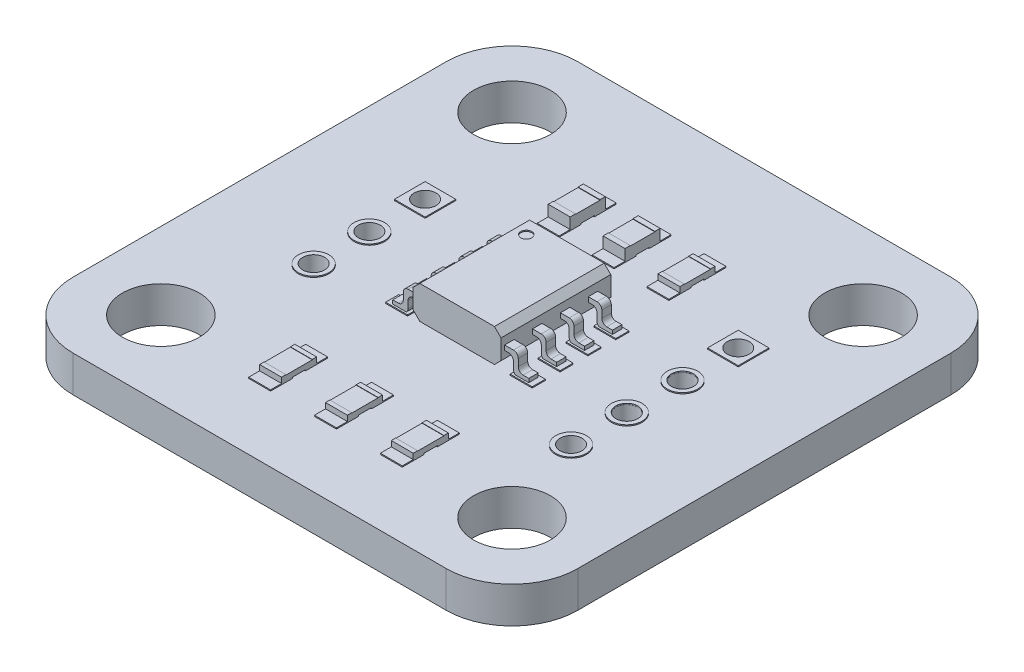
from build123d import *
from build123d.topology import SkipClean

# Parameters (mm, degrees)
SKETCH1_R              = 1.75
SKETCH1_R_2            = 0.5
BOSS_EXTRUDE1_DEPTH    = 1.65
SKETCH3_R              = 0.7
SKETCH3_R_2            = 0.5
SKETCH3_R_3            = 0.503152614
SKETCH3_W              = 1.4
SKETCH3_H              = 1.4
BOSS_EXTRUDE2_DEPTH    = 0.05
BOSS_EXTRUDE4_DEPTH    = 5
BOSS_EXTRUDE6_DEPTH    = 0.43
FILLET1_R              = 0.22
LPATTERN3_COUNT        = 3
LPATTERN3_PITCH        = 1.27
FILLET1_OF_LPATTERN3_R = 0.22
LPATTERN4_COUNT        = 2
LPATTERN4_PITCH        = 1.27
FILLET1_OF_LPATTERN4_R = 0.22
MIRROR2_START          = -1.905
MIRROR2_DEPTH          = 0.43
MIRROR2_START_2        = -0.635
MIRROR2_2_DEPTH        = 0.43
MIRROR2_START_3        = 0.635
MIRROR2_3_DEPTH        = 0.43
MIRROR2_START_4        = 1.905
MIRROR2_4_DEPTH        = 0.43
BOSS_EXTRUDE7_START    = 0.05
SKETCH8_R              = 0.7
SKETCH8_R_2            = 0.5
SKETCH8_W              = 1.4
SKETCH8_H              = 1.4
BOSS_EXTRUDE7_DEPTH    = 0.05
SKETCH9_R              = 0.25
CUT_EXTRUDE1_DEPTH     = 0.05
SKETCH10_W             = 1
SKETCH10_H             = 0.6
BOSS_EXTRUDE8_DEPTH    = 0.05
SKETCH12_W             = 1
SKETCH12_H             = 1
BOSS_EXTRUDE9_DEPTH    = 0.05
SKETCH15_W             = 1
SKETCH15_H             = 1.6
BOSS_EXTRUDE11_DEPTH   = 0.25
SKETCH16_W             = 1
SKETCH16_H             = 1.2
CUT_EXTRUDE4_DEPTH     = 0.015
SKETCH17_W             = 1
SKETCH17_H             = 1.6
BOSS_EXTRUDE12_DEPTH   = 0.5
SKETCH18_W             = 1
SKETCH18_H             = 1.12020849
CUT_EXTRUDE5_DEPTH     = 0.02


# Read off the part's stored shape, not the designer's step: Mirror2
with BuildPart() as part:
    # Sketch1 → Boss-Extrude1 (new body)
    with BuildSketch(Plane(origin=(0, 0, 0), x_dir=(1, 0, 0), z_dir=(0, 1, 0))):
        with BuildLine():
            Line((-8.5, 11.5), (8.5, 11.5))
            ThreePointArc((8.5, 11.5), (10.621320344, 10.621320344), (11.5, 8.5))
            Line((11.5, 8.5), (11.5, -8.5))
            ThreePointArc((11.5, -8.5), (10.621320344, -10.621320344), (8.5, -11.5))
            Line((8.5, -11.5), (-8.5, -11.5))
            ThreePointArc((-8.5, -11.5), (-10.621320344, -10.621320344), (-11.5, -8.5))
            Line((-11.5, -8.5), (-11.5, 8.5))
            ThreePointArc((-11.5, 8.5), (-10.621320344, 10.621320344), (-8.5, 11.5))
        make_face()
        with Locations(Location((-8, 8, 0), (0, 0, 270))):
            Circle(SKETCH1_R, mode=Mode.SUBTRACT)
        with Locations(Location((8, 8, 0), (0, 0, 270))):
            Circle(SKETCH1_R, mode=Mode.SUBTRACT)
        with Locations(Location((8, -8, 0), (0, 0, 270))):
            Circle(SKETCH1_R, mode=Mode.SUBTRACT)
        with Locations(Location((-8, -8, 0), (0, 0, 270))):
            Circle(SKETCH1_R, mode=Mode.SUBTRACT)
        with Locations(Location((-6.5, 0, 0), (0, 0, 270))):
            Circle(SKETCH1_R_2, mode=Mode.SUBTRACT)
        with Locations(Location((-6.5, 2.54, 0), (0, 0, 270))):
            Circle(SKETCH1_R_2, mode=Mode.SUBTRACT)
        with Locations(Location((-6.5, -2.54, 0), (0, 0, 270))):
            Circle(SKETCH1_R_2, mode=Mode.SUBTRACT)
        with Locations(Location((6.5, 3.81, 0), (0, 0, 270))):
            Circle(SKETCH1_R_2, mode=Mode.SUBTRACT)
        with Locations(Location((6.5, 1.27, 0), (0, 0, 270))):
            Circle(SKETCH1_R_2, mode=Mode.SUBTRACT)
        with Locations(Location((6.5, -1.27, 0), (0, 0, 270))):
            Circle(SKETCH1_R_2, mode=Mode.SUBTRACT)
        with Locations(Location((6.5, -3.81, 0), (0, 0, 270))):
            Circle(SKETCH1_R_2, mode=Mode.SUBTRACT)
    extrude(amount=BOSS_EXTRUDE1_DEPTH)

    # Sketch3 → Boss-Extrude2 (add)
    # profile 1 of 7: a face of its own
    with BuildSketch(Plane(origin=(0, 1.65, 0), x_dir=(1, 0, 0), z_dir=(0, 1, 0))):
        with Locations(Location((-6.5, 0, 0), (0, 0, 90))):
            Circle(SKETCH3_R)
        with Locations(Location((-6.5, 0, 0), (0, 0, 270))):
            Circle(SKETCH3_R_2, mode=Mode.SUBTRACT)
    # profile 2 of 7: a face of its own
    with BuildSketch(Plane(origin=(0, 1.65, 0), x_dir=(1, 0, 0), z_dir=(0, 1, 0))):
        with Locations(Location((-6.5, -2.54, 0), (0, 0, 90))):
            Circle(SKETCH3_R)
        with Locations(Location((-6.5, -2.54, 0), (0, 0, 270))):
            Circle(SKETCH3_R_2, mode=Mode.SUBTRACT)
    # profile 3 of 7: a face of its own
    with BuildSketch(Plane(origin=(0, 1.65, 0), x_dir=(1, 0, 0), z_dir=(0, 1, 0))):
        with Locations(Location((6.5, 1.27, 0), (0, 0, 90))):
            Circle(SKETCH3_R)
        with Locations(Location((6.5, 1.27, 0), (0, 0, 270))):
            Circle(SKETCH3_R_3, mode=Mode.SUBTRACT)
    # profile 4 of 7: a face of its own
    with BuildSketch(Plane(origin=(0, 1.65, 0), x_dir=(1, 0, 0), z_dir=(0, 1, 0))):
        with Locations(Location((6.5, -1.27, 0), (0, 0, 90))):
            Circle(SKETCH3_R)
        with Locations(Location((6.5, -1.27, 0), (0, 0, 270))):
            Circle(SKETCH3_R_3, mode=Mode.SUBTRACT)
    # profile 5 of 7: a face of its own
    with BuildSketch(Plane(origin=(0, 1.65, 0), x_dir=(1, 0, 0), z_dir=(0, 1, 0))):
        with Locations(Location((6.5, -3.81, 0), (0, 0, 90))):
            Circle(SKETCH3_R)
        with Locations(Location((6.5, -3.81, 0), (0, 0, 270))):
            Circle(SKETCH3_R_2, mode=Mode.SUBTRACT)
    # profile 6 of 7: a face of its own
    with BuildSketch(Plane(origin=(0, 1.65, 0), x_dir=(1, 0, 0), z_dir=(0, 1, 0))):
        with Locations((-6.5, 2.54)):
            Rectangle(SKETCH3_W, SKETCH3_H)
        with Locations(Location((-6.5, 2.54, 0), (0, 0, 270))):
            Circle(SKETCH3_R_2, mode=Mode.SUBTRACT)
    # profile 7 of 7: a face of its own
    with BuildSketch(Plane(origin=(0, 1.65, 0), x_dir=(1, 0, 0), z_dir=(0, 1, 0))):
        with Locations((6.5, 3.81)):
            Rectangle(SKETCH3_W, SKETCH3_H)
        with Locations(Location((6.5, 3.81, 0), (0, 0, 270))):
            Circle(SKETCH3_R_2, mode=Mode.SUBTRACT)
    extrude(amount=BOSS_EXTRUDE2_DEPTH)



with BuildPart() as body_2:
    # Sketch6 → Boss-Extrude4 (new body)
    with BuildSketch(Plane.XY.offset(2.5)):
        Polygon((-1.7, 3.3), (1.7, 3.3), (2, 3), (2, 2.1), (1.7, 1.8), (-1.7, 1.8), (-2, 2.1), (-2, 3), align=None)
    extrude(amount=-BOSS_EXTRUDE4_DEPTH)


with BuildPart() as part_1:
    add(part.part)

    add(body_2.part)  # Boss-Extrude6 merges body 2
    # Sketch7 → Boss-Extrude6 (add)
    with BuildSketch(Plane.XY.offset(0.635)):
        with BuildLine():
            Line((2.839, 1.87), (3.1, 1.87))
            Line((3.1, 1.87), (3.1, 1.65))
            Line((3.1, 1.65), (2.619, 1.65))
            ThreePointArc((2.619, 1.65), (2.464143615, 1.714143615), (2.4, 1.87))
            Line((2.4, 1.87), (2.4, 2.418859775))
            Line((2.4, 2.418859775), (2, 2.418859775))
            Line((2, 2.418859775), (2, 2.638859775))
            Line((2, 2.638859775), (2.4, 2.638859775))
            Line((2.4, 2.638859775), (2.62, 2.638859775))
            Line((2.62, 2.638859775), (2.62, 2.089))
            ThreePointArc((2.62, 2.089), (2.684143615, 1.934143615), (2.839, 1.87))
        make_face()
    boss_extrude6 = extrude(amount=BOSS_EXTRUDE6_DEPTH)

    # Fillet1
    fillet1_edges = [part_1.edges().sort_by_distance(p)[0] for p in [
        (2.62, 2.638859775, 0.85),
        (2.4, 2.418859775, 0.85),
    ]]
    fillet(fillet1_edges, radius=FILLET1_R)

    # LPattern3: Boss-Extrude6 ×3
    with Locations(*[(0, 0, -i * LPATTERN3_PITCH) for i in range(1, LPATTERN3_COUNT)]):
        add(boss_extrude6)

    # Fillet1 of LPattern3
    fillet1_of_lpattern3_edges = [part_1.edges().sort_by_distance(p)[0] for p in [
        (2.62, 2.638859775, -0.42),
        (2.4, 2.418859775, -0.42),
        (2.62, 2.638859775, -1.69),
        (2.4, 2.418859775, -1.69),
    ]]
    fillet(fillet1_of_lpattern3_edges, radius=FILLET1_OF_LPATTERN3_R)

    # LPattern4: Boss-Extrude6 ×2
    with Locations(*[(0, 0, i * LPATTERN4_PITCH) for i in range(1, LPATTERN4_COUNT)]):
        add(boss_extrude6)

    # Fillet1 of LPattern4
    fillet1_of_lpattern4_edges = [part_1.edges().sort_by_distance(p)[0] for p in [
        (2.62, 2.638859775, 2.12),
        (2.4, 2.418859775, 2.12),
    ]]
    fillet(fillet1_of_lpattern4_edges, radius=FILLET1_OF_LPATTERN4_R)

    # Mirror2 outline → Mirror2 (add)
    with BuildSketch(Plane.XY.offset(MIRROR2_START)):
        with BuildLine():
            ThreePointArc((-2.62, 2.089), (-2.684143615, 1.934143615), (-2.839, 1.87))
            Line((-2.839, 1.87), (-3.1, 1.87))
            Line((-3.1, 1.87), (-3.1, 1.65))
            Line((-3.1, 1.65), (-2.619, 1.65))
            ThreePointArc((-2.619, 1.65), (-2.464143615, 1.714143615), (-2.4, 1.869))
            Line((-2.4, 1.869), (-2.4, 2.198859775))
            ThreePointArc((-2.4, 2.198859775), (-2.335563492, 2.354423267), (-2.18, 2.418859775))
            Line((-2.18, 2.418859775), (-2, 2.418859775))
            Line((-2, 2.418859775), (-2, 2.638859775))
            Line((-2, 2.638859775), (-2.4, 2.638859775))
            ThreePointArc((-2.4, 2.638859775), (-2.555563492, 2.574423267), (-2.62, 2.418859775))
            Line((-2.62, 2.418859775), (-2.62, 2.089))
        make_face()
    extrude(amount=MIRROR2_DEPTH)

    # Mirror2 2 outline → Mirror2 2 (add)
    with BuildSketch(Plane.XY.offset(MIRROR2_START_2)):
        with BuildLine():
            ThreePointArc((-2.62, 2.089), (-2.684143615, 1.934143615), (-2.839, 1.87))
            Line((-2.839, 1.87), (-3.1, 1.87))
            Line((-3.1, 1.87), (-3.1, 1.65))
            Line((-3.1, 1.65), (-2.619, 1.65))
            ThreePointArc((-2.619, 1.65), (-2.464143615, 1.714143615), (-2.4, 1.869))
            Line((-2.4, 1.869), (-2.4, 2.198859775))
            ThreePointArc((-2.4, 2.198859775), (-2.335563492, 2.354423267), (-2.18, 2.418859775))
            Line((-2.18, 2.418859775), (-2, 2.418859775))
            Line((-2, 2.418859775), (-2, 2.638859775))
            Line((-2, 2.638859775), (-2.4, 2.638859775))
            ThreePointArc((-2.4, 2.638859775), (-2.555563492, 2.574423267), (-2.62, 2.418859775))
            Line((-2.62, 2.418859775), (-2.62, 2.089))
        make_face()
    extrude(amount=MIRROR2_2_DEPTH)

    # Mirror2 3 outline → Mirror2 3 (add)
    with BuildSketch(Plane.XY.offset(MIRROR2_START_3)):
        with BuildLine():
            ThreePointArc((-2.62, 2.089), (-2.684143615, 1.934143615), (-2.839, 1.87))
            Line((-2.839, 1.87), (-3.1, 1.87))
            Line((-3.1, 1.87), (-3.1, 1.65))
            Line((-3.1, 1.65), (-2.619, 1.65))
            ThreePointArc((-2.619, 1.65), (-2.464143615, 1.714143615), (-2.4, 1.869))
            Line((-2.4, 1.869), (-2.4, 2.198859775))
            ThreePointArc((-2.4, 2.198859775), (-2.335563492, 2.354423267), (-2.18, 2.418859775))
            Line((-2.18, 2.418859775), (-2, 2.418859775))
            Line((-2, 2.418859775), (-2, 2.638859775))
            Line((-2, 2.638859775), (-2.4, 2.638859775))
            ThreePointArc((-2.4, 2.638859775), (-2.555563492, 2.574423267), (-2.62, 2.418859775))
            Line((-2.62, 2.418859775), (-2.62, 2.089))
        make_face()
    extrude(amount=MIRROR2_3_DEPTH)

    # Mirror2 4 outline → Mirror2 4 (add)
    with BuildSketch(Plane.XY.offset(MIRROR2_START_4)):
        with BuildLine():
            ThreePointArc((-2.62, 2.089), (-2.684143615, 1.934143615), (-2.839, 1.87))
            Line((-2.839, 1.87), (-3.1, 1.87))
            Line((-3.1, 1.87), (-3.1, 1.65))
            Line((-3.1, 1.65), (-2.619, 1.65))
            ThreePointArc((-2.619, 1.65), (-2.464143615, 1.714143615), (-2.4, 1.869))
            Line((-2.4, 1.869), (-2.4, 2.198859775))
            ThreePointArc((-2.4, 2.198859775), (-2.335563492, 2.354423267), (-2.18, 2.418859775))
            Line((-2.18, 2.418859775), (-2, 2.418859775))
            Line((-2, 2.418859775), (-2, 2.638859775))
            Line((-2, 2.638859775), (-2.4, 2.638859775))
            ThreePointArc((-2.4, 2.638859775), (-2.555563492, 2.574423267), (-2.62, 2.418859775))
            Line((-2.62, 2.418859775), (-2.62, 2.089))
        make_face()
    extrude(amount=MIRROR2_4_DEPTH)

    # Sketch8 → Boss-Extrude7 (add)
    # profile 1 of 7: a face of its own
    with SkipClean():  # the faces are left unmerged after this step: merging them gives an invalid solid
        with BuildSketch(Plane(origin=(0, 0, 0), x_dir=(-1, 0, 0), z_dir=(0, -1, 0)).offset(BOSS_EXTRUDE7_START)):
            with Locations(Location((6.5, -2.54, 0), (0, 0, 90))):
                Circle(SKETCH8_R)
            with Locations(Location((6.5, -2.54, 0), (0, 0, 90))):
                Circle(SKETCH8_R_2, mode=Mode.SUBTRACT)
        # profile 2 of 7: a face of its own
        with BuildSketch(Plane(origin=(0, 0, 0), x_dir=(-1, 0, 0), z_dir=(0, -1, 0)).offset(BOSS_EXTRUDE7_START)):
            with Locations(Location((6.5, 0, 0), (0, 0, 90))):
                Circle(SKETCH8_R)
            with Locations(Location((6.5, 0, 0), (0, 0, 90))):
                Circle(SKETCH8_R_2, mode=Mode.SUBTRACT)
        # profile 3 of 7: a face of its own
        with BuildSketch(Plane(origin=(0, 0, 0), x_dir=(-1, 0, 0), z_dir=(0, -1, 0)).offset(BOSS_EXTRUDE7_START)):
            with Locations(Location((-6.5, 1.27, 0), (0, 0, 90))):
                Circle(SKETCH8_R)
            with Locations(Location((-6.5, 1.27, 0), (0, 0, 90))):
                Circle(SKETCH8_R_2, mode=Mode.SUBTRACT)
        # profile 4 of 7: a face of its own
        with BuildSketch(Plane(origin=(0, 0, 0), x_dir=(-1, 0, 0), z_dir=(0, -1, 0)).offset(BOSS_EXTRUDE7_START)):
            with Locations(Location((-6.5, -1.27, 0), (0, 0, 90))):
                Circle(SKETCH8_R)
            with Locations(Location((-6.5, -1.27, 0), (0, 0, 90))):
                Circle(SKETCH8_R_2, mode=Mode.SUBTRACT)
        # profile 5 of 7: a face of its own
        with BuildSketch(Plane(origin=(0, 0, 0), x_dir=(-1, 0, 0), z_dir=(0, -1, 0)).offset(BOSS_EXTRUDE7_START)):
            with Locations(Location((-6.5, -3.81, 0), (0, 0, 90))):
                Circle(SKETCH8_R)
            with Locations(Location((-6.5, -3.81, 0), (0, 0, 90))):
                Circle(SKETCH8_R_2, mode=Mode.SUBTRACT)
        # profile 6 of 7: a face of its own
        with BuildSketch(Plane(origin=(0, 0, 0), x_dir=(-1, 0, 0), z_dir=(0, -1, 0)).offset(BOSS_EXTRUDE7_START)):
            with Locations((-6.5, 3.81)):
                Rectangle(SKETCH8_W, SKETCH8_H)
            with Locations(Location((-6.5, 3.81, 0), (0, 0, 90))):
                Circle(SKETCH8_R_2, mode=Mode.SUBTRACT)
        # profile 7 of 7: a face of its own
        with BuildSketch(Plane(origin=(0, 0, 0), x_dir=(-1, 0, 0), z_dir=(0, -1, 0)).offset(BOSS_EXTRUDE7_START)):
            with Locations((6.5, 2.54)):
                Rectangle(SKETCH8_W, SKETCH8_H)
            with Locations(Location((6.5, 2.54, 0), (0, 0, 90))):
                Circle(SKETCH8_R_2, mode=Mode.SUBTRACT)
        extrude(amount=-BOSS_EXTRUDE7_DEPTH)

    # Sketch9 → Cut-Extrude1 (cut)
    with SkipClean():  # the faces are left unmerged after this step: merging them gives an invalid solid
        with BuildSketch(Plane(origin=(0, 3.3, 0), x_dir=(1, 0, 0), z_dir=(0, 1, 0))):
            with Locations(Location((-1.2, 1.85, 0), (0, 0, 180))):
                Circle(SKETCH9_R)
        extrude(amount=-CUT_EXTRUDE1_DEPTH, mode=Mode.SUBTRACT)

    # Sketch10 → Boss-Extrude8 (add)
    with SkipClean():  # the faces are left unmerged after this step: merging them gives an invalid solid
        with BuildSketch(Plane(origin=(0, 1.65, 0), x_dir=(1, 0, 0), z_dir=(0, 1, 0))):
            with Locations((-2.839, -2.12)):
                Rectangle(SKETCH10_W, SKETCH10_H)
            with Locations((-2.839, -0.85)):
                Rectangle(SKETCH10_W, SKETCH10_H)
            with Locations((-2.839, 0.42)):
                Rectangle(SKETCH10_W, SKETCH10_H)
            with Locations((-2.839, 1.69)):
                Rectangle(SKETCH10_W, SKETCH10_H)
            with Locations((2.839, 1.69)):
                Rectangle(SKETCH10_W, SKETCH10_H)
            with Locations((2.839, 0.42)):
                Rectangle(SKETCH10_W, SKETCH10_H)
            with Locations((2.839, -0.85)):
                Rectangle(SKETCH10_W, SKETCH10_H)
            with Locations((2.839, -2.12)):
                Rectangle(SKETCH10_W, SKETCH10_H)
        extrude(amount=BOSS_EXTRUDE8_DEPTH)

    # Sketch12 → Boss-Extrude9 (add)
    with SkipClean():  # the faces are left unmerged after this step: merging them gives an invalid solid
        with BuildSketch(Plane(origin=(0, 1.65, 0), x_dir=(1, 0, 0), z_dir=(0, 1, 0))):
            with Locations((2.5, 6.25)):
                Rectangle(SKETCH12_W, SKETCH12_H)
            with Locations((0, 4.65)):
                Rectangle(SKETCH12_W, SKETCH12_H)
            with Locations((0, 6.25)):
                Rectangle(SKETCH12_W, SKETCH12_H)
            with Locations((2.5, 4.65)):
                Rectangle(SKETCH12_W, SKETCH12_H)
            with Locations((-2.5, 6.25)):
                Rectangle(SKETCH12_W, SKETCH12_H)
            with Locations((-2.5, 4.65)):
                Rectangle(SKETCH12_W, SKETCH12_H)
            with Locations((3, -8)):
                Rectangle(SKETCH12_W, SKETCH12_H)
            with Locations((0, -6.4)):
                Rectangle(SKETCH12_W, SKETCH12_H)
            with Locations((0, -8)):
                Rectangle(SKETCH12_W, SKETCH12_H)
            with Locations((3, -6.4)):
                Rectangle(SKETCH12_W, SKETCH12_H)
            with Locations((-3, -8)):
                Rectangle(SKETCH12_W, SKETCH12_H)
            with Locations((-3, -6.4)):
                Rectangle(SKETCH12_W, SKETCH12_H)
        extrude(amount=BOSS_EXTRUDE9_DEPTH)

    # Sketch15 → Boss-Extrude11 (add)
    with SkipClean():  # the faces are left unmerged after this step: merging them gives an invalid solid
        with BuildSketch(Plane(origin=(0, 1.7, 0), x_dir=(1, 0, 0), z_dir=(0, 1, 0))):
            with Locations((-3, -7.2)):
                Rectangle(SKETCH15_W, SKETCH15_H)
            with Locations((0, -7.2)):
                Rectangle(SKETCH15_W, SKETCH15_H)
            with Locations((3, -7.2)):
                Rectangle(SKETCH15_W, SKETCH15_H)
            with Locations((2.5, 5.45)):
                Rectangle(SKETCH15_W, SKETCH15_H)
        extrude(amount=BOSS_EXTRUDE11_DEPTH)

    # Sketch16 → Cut-Extrude4 (cut)
    with SkipClean():  # the faces are left unmerged after this step: merging them gives an invalid solid
        with BuildSketch(Plane(origin=(0, 1.95, 0), x_dir=(1, 0, 0), z_dir=(0, 1, 0))):
            with Locations((2.5, 5.45)):
                Rectangle(SKETCH16_W, SKETCH16_H)
            with Locations((-3, -7.2)):
                Rectangle(SKETCH16_W, SKETCH16_H)
            with Locations((0, -7.2)):
                Rectangle(SKETCH16_W, SKETCH16_H)
            with Locations((3, -7.2)):
                Rectangle(SKETCH16_W, SKETCH16_H)
        extrude(amount=-CUT_EXTRUDE4_DEPTH, mode=Mode.SUBTRACT)

    # Sketch17 → Boss-Extrude12 (add)
    with SkipClean():  # the faces are left unmerged after this step: merging them gives an invalid solid
        with BuildSketch(Plane(origin=(0, 1.7, 0), x_dir=(1, 0, 0), z_dir=(0, 1, 0))):
            with Locations((-2.5, 5.45)):
                Rectangle(SKETCH17_W, SKETCH17_H)
            with Locations((0, 5.45)):
                Rectangle(SKETCH17_W, SKETCH17_H)
        extrude(amount=BOSS_EXTRUDE12_DEPTH)

    # Sketch18 → Cut-Extrude5 (cut)
    with SkipClean():  # the faces are left unmerged after this step: merging them gives an invalid solid
        with BuildSketch(Plane(origin=(0, 2.2, 0), x_dir=(1, 0, 0), z_dir=(0, 1, 0))):
            with Locations((-2.5, 5.45)):
                Rectangle(SKETCH18_W, SKETCH18_H)
            with Locations((0, 5.45)):
                Rectangle(SKETCH18_W, SKETCH18_H)
        extrude(amount=-CUT_EXTRUDE5_DEPTH, mode=Mode.SUBTRACT)


solid = part_1.part
